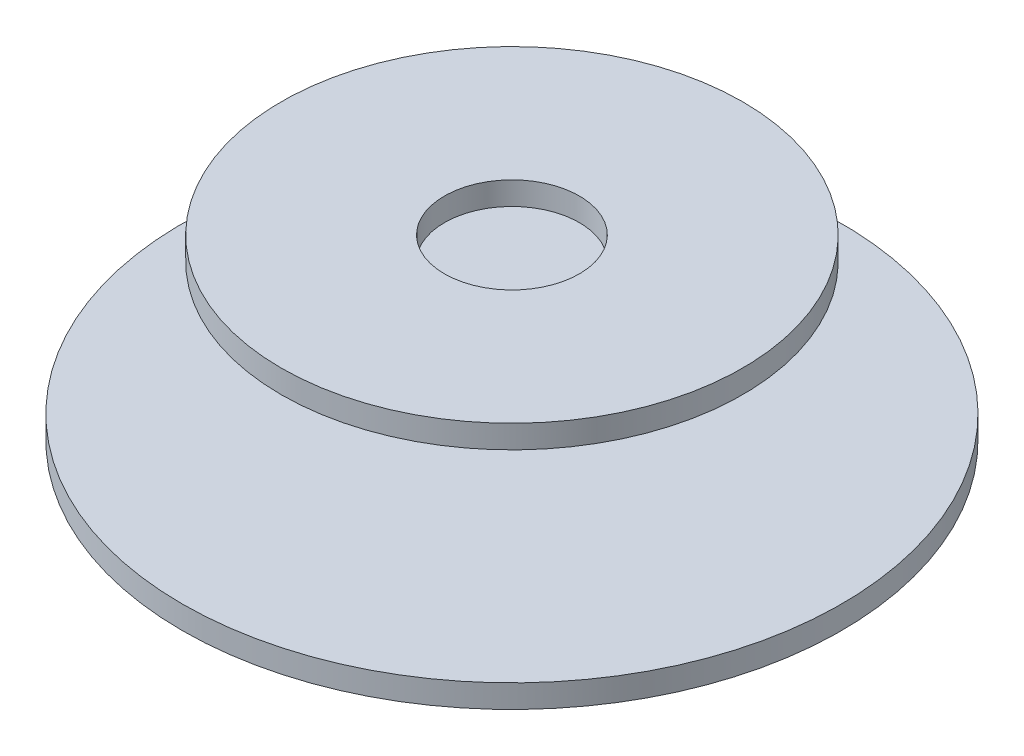
from build123d import *

# Parameters (mm, degrees)
SKETCH1_R           = 127
BASE_OF_BASE_DEPTH  = 8.89
SKETCH3_R           = 88.9
SKETCH3_R_2         = 26
BOSS_EXTRUDE2_DEPTH = 8.89


with BuildPart() as part:
    # Sketch1 → Base of base (new body)
    with BuildSketch(Plane(origin=(0, 0, 0), x_dir=(1, 0, 0), z_dir=(0, 1, 0))):
        Circle(SKETCH1_R)
    extrude(amount=BASE_OF_BASE_DEPTH)


with BuildPart() as body_2:
    # Sketch3 → Boss-Extrude2 (new body)
    with BuildSketch(Plane(origin=(0, 59.69, 0), x_dir=(1, 0, 0), z_dir=(0, 1, 0))):
        Circle(SKETCH3_R)
        Circle(SKETCH3_R_2, mode=Mode.SUBTRACT)
    extrude(amount=BOSS_EXTRUDE2_DEPTH)


solid = Compound([part.part, body_2.part])
